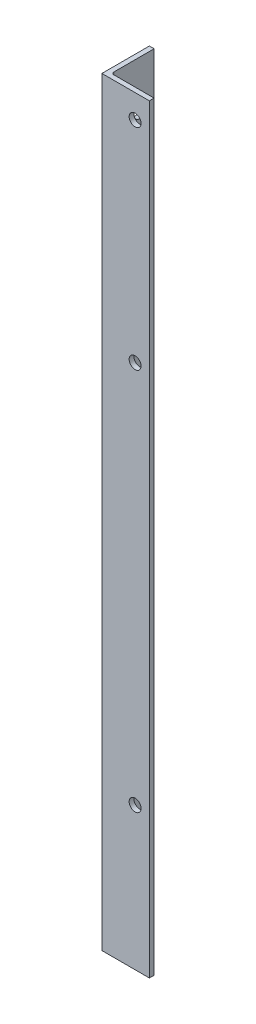
from build123d import *

# Parameters (mm, degrees)
BOSS_EXTRUDE1_DEPTH              = 508
LEFTSIDEHOLES_SKETCH3_R          = 4
LEFTSIDEHOLES_CUT_EXTRUDE1_DEPTH = 3.175
BACKSIDEHOLES_SKETCH4_R          = 4
BACKSIDEHOLES_CUT_EXTRUDE2_DEPTH = 3.175


with BuildPart() as part:
    # Sketch2 → Boss-Extrude1 (new body)
    with BuildSketch(Plane(origin=(0, 0, 0), x_dir=(1, 0, 0), z_dir=(0, 1, 0))):
        with BuildLine():
            Line((0, 31.75), (3.175, 31.75))
            Line((3.175, 31.75), (3.175, 4.7625))
            ThreePointArc((3.175, 4.7625), (3.639967985, 3.639967985), (4.7625, 3.175))
            Line((4.7625, 3.175), (31.75, 3.175))
            Line((31.75, 3.175), (31.75, 0))
            Line((31.75, 0), (0, 0))
            Line((0, 0), (0, 31.75))
        make_face()
    extrude(amount=BOSS_EXTRUDE1_DEPTH)

    # LeftSideHoles-Sketch3 → LeftSideHoles-Cut-Extrude1 (cut)
    with BuildSketch(Plane.XY):
        with Locations((22.225, 95.4)):
            Circle(LEFTSIDEHOLES_SKETCH3_R)
        with Locations((22.225, 492.125)):
            Circle(LEFTSIDEHOLES_SKETCH3_R)
        with Locations((22.225, 351.58487)):
            Circle(LEFTSIDEHOLES_SKETCH3_R)
    extrude(amount=-LEFTSIDEHOLES_CUT_EXTRUDE1_DEPTH, mode=Mode.SUBTRACT)

    # BackSideHoles-Sketch4 → BackSideHoles-Cut-Extrude2 (cut)
    with BuildSketch(Plane.ZY):
        with Locations((-22.225, 95.4)):
            Circle(BACKSIDEHOLES_SKETCH4_R)
        with Locations((-22.225, 476.25)):
            Circle(BACKSIDEHOLES_SKETCH4_R)
    extrude(amount=-BACKSIDEHOLES_CUT_EXTRUDE2_DEPTH, mode=Mode.SUBTRACT)


solid = part.part
